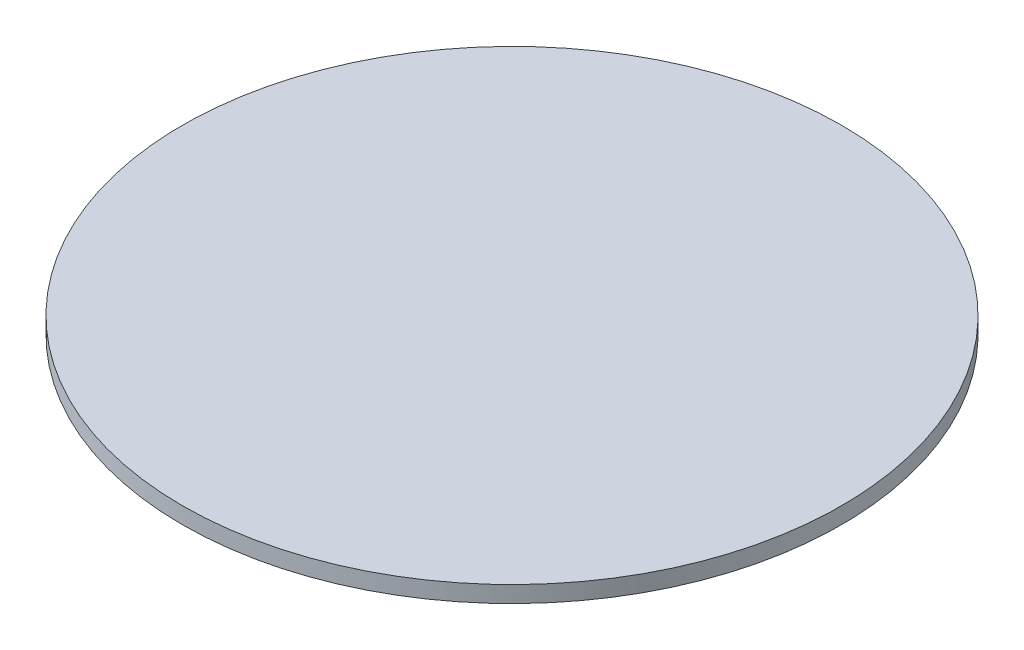
from build123d import *

# Parameters (mm, degrees)
SKETCH1_R           = 300
BOSS_EXTRUDE1_DEPTH = 15


with BuildPart() as part:
    # Sketch1 → Boss-Extrude1 (new body)
    with BuildSketch(Plane(origin=(0, 0, 0), x_dir=(1, 0, 0), z_dir=(0, 1, 0))):
        Circle(SKETCH1_R)
    extrude(amount=BOSS_EXTRUDE1_DEPTH)


solid = part.part
